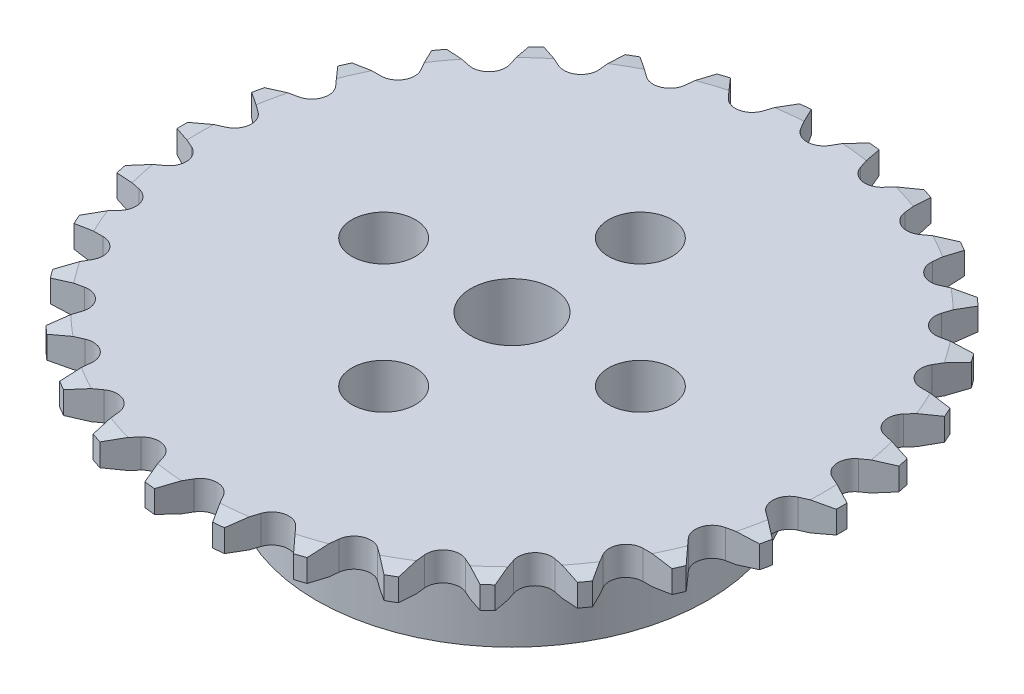
from build123d import *

# Parameters (mm, degrees)
CUT_EXTRUDE1_REACH      = 50.109
CIRPATTERN1_START       = -2.794
CIRPATTERN1_DEPTH       = 2.794
SKETCH3_R               = 4
CUT_EXTRUDE2_DEPTH      = 49.025751431
SKETCH4_R               = 19.05
CUT_EXTRUDE3_DEPTH      = 1.081
CUT_EXTRUDE4_DEPTH      = 47.887708149
CUT_EXTRUDE4_DEPTH_BACK = 47.887708149
SKETCH5_R               = 3.1


# Read off the part's stored shape, not the designer's step: CirPattern1
with BuildPart() as part:
    # Sketch1 → Revolve2 (revolve)
    with BuildSketch(Plane.XY, mode=Mode.PRIVATE) as revolve2_sk:
        Polygon((0, 0), (30.374501841, 0), (32.113107142, -0.306563023), (32.113107142, -2.487436977), (30.374501841, -2.794), (19.05, -2.794), (19.05, -15.375), (18.55, -15.875), (0, -15.875), align=None)
    revolve(revolve2_sk.sketch.rotate(Axis((0, 0, 0), (0, -1, 0)), 180), axis=Axis((0, 0, 0), (0, -1, 0)))

    # Cut-Extrude1: up to this face of the body (flat: up to its plane)
    cut_extrude1_end = Plane(part.part.faces().sort_by_distance((29.515381192, -2.794, 0))[0])
    # Sketch2 → Cut-Extrude1 (cut, up to the picked face)
    with BuildSketch(Plane(origin=(0, 0, 0), x_dir=(1, 0, 0), z_dir=(0, 1, 0)), mode=Mode.PRIVATE) as cut_extrude1_sk1:
        with BuildLine():
            Line((1.428941916, 29.549501841), (2.836569262, 31.987583922))
            ThreePointArc((2.836569262, 31.987583922), (0, 32.113107142), (-2.836569262, 31.987583922))
            Line((-2.836569262, 31.987583922), (-1.428941916, 29.549501841))
            ThreePointArc((-1.428941916, 29.549501841), (0, 28.724501841), (1.428941916, 29.549501841))
        make_face()
    cut_extrude1_tool1 = split(extrude(cut_extrude1_sk1.sketch, amount=-CUT_EXTRUDE1_REACH, mode=Mode.PRIVATE), bisect_by=cut_extrude1_end, keep=Keep.BOTH, mode=Mode.PRIVATE)
    add(cut_extrude1_tool1.solids().sort_by(Axis((0, 0, -30.720189), (0, -1, 0)))[0], mode=Mode.SUBTRACT)

    # CirPattern1 outline → CirPattern1 (cut)
    with BuildSketch(Plane(origin=(0, 0, 0), x_dir=(1, 0, 0), z_dir=(0, 1, 0)).offset(CIRPATTERN1_START)):
        with BuildLine():
            ThreePointArc((-29.120344913, -13.537250921), (-27.810766579, -16.056553571), (-26.283775651, -18.450333001))
            Line((-26.283775651, -18.450333001), (-24.876148306, -16.012250921))
            ThreePointArc((-24.876148306, -16.012250921), (-24.876148306, -14.362250921), (-26.305090222, -13.537250921))
            Line((-26.305090222, -13.537250921), (-29.120344913, -13.537250921))
        make_face()
        with BuildLine():
            ThreePointArc((-3.876009241, 31.878334378), (-6.676690404, 31.411358704), (-9.425176076, 30.698822555))
            Line((-9.425176076, 30.698822555), (-7.541402998, 28.606680599))
            ThreePointArc((-7.541402998, 28.606680599), (-5.972159746, 28.096802558), (-4.745970784, 29.200868059))
            Line((-4.745970784, 29.200868059), (-3.876009241, 31.878334378))
        make_face()
        with BuildLine():
            ThreePointArc((-10.41918754, 30.375848652), (-13.061577398, 29.336783161), (-15.601857469, 28.068375333))
            Line((-15.601857469, 28.068375333), (-13.32426858, 26.413610145))
            ThreePointArc((-13.32426858, 26.413610145), (-11.683307453, 26.24113818), (-10.713461787, 27.576016221))
            Line((-10.713461787, 27.576016221), (-10.41918754, 30.375848652))
        make_face()
        with BuildLine():
            ThreePointArc((-16.506997347, 27.545792581), (-18.875610783, 25.980049421), (-21.096662824, 24.211205423))
            Line((-21.096662824, 24.211205423), (-18.524799689, 23.06613818))
            ThreePointArc((-18.524799689, 23.06613818), (-16.883838562, 23.238610145), (-16.212723101, 24.74596015))
            Line((-16.212723101, 24.74596015), (-16.506997347, 27.545792581))
        make_face()
        with BuildLine():
            ThreePointArc((-21.873372161, 23.511853194), (-23.864689403, 21.487862854), (-25.669442781, 19.295889657))
            Line((-25.669442781, 19.295889657), (-22.91570816, 18.710565294))
            ThreePointArc((-22.91570816, 18.710565294), (-21.346464908, 19.220443334), (-21.003410618, 20.834386876))
            Line((-21.003410618, 20.834386876), (-21.873372161, 23.511853194))
        make_face()
        with BuildLine():
            ThreePointArc((-26.283775651, 18.450333001), (-27.81076658, 16.056553571), (-29.120344913, 13.537250921))
            Line((-29.120344913, 13.537250921), (-26.305090222, 13.537250921))
            ThreePointArc((-26.305090222, 13.537250921), (-24.876148306, 14.362250921), (-24.876148306, 16.012250921))
            Line((-24.876148306, 16.012250921), (-26.283775651, 18.450333001))
        make_face()
        with BuildLine():
            ThreePointArc((-29.545452022, 12.582444721), (-30.541379806, 9.923495849), (-31.298548237, 7.186969361))
            Line((-31.298548237, 7.186969361), (-28.544813616, 7.772293723))
            ThreePointArc((-28.544813616, 7.772293723), (-27.318624654, 8.876359224), (-27.661678943, 10.490302765))
            Line((-27.661678943, 10.490302765), (-29.545452022, 12.582444721))
        make_face()
        with BuildLine():
            ThreePointArc((-31.515850364, 6.164643229), (-31.937188181, 3.35673374), (-32.108854816, 0.522582753))
            Line((-32.108854816, 0.522582753), (-29.536991681, 1.667649995))
            ThreePointArc((-29.536991681, 1.667649995), (-28.567146015, 3.002528036), (-29.238261476, 4.509878041))
            Line((-29.238261476, 4.509878041), (-31.515850364, 6.164643229))
        make_face()
        with BuildLine():
            ThreePointArc((-32.108854816, -0.522582753), (-31.937188181, -3.35673374), (-31.515850364, -6.164643229))
            Line((-31.515850364, -6.164643229), (-29.238261476, -4.509878041))
            ThreePointArc((-29.238261476, -4.509878041), (-28.567146015, -3.002528036), (-29.536991681, -1.667649995))
            Line((-29.536991681, -1.667649995), (-32.108854816, -0.522582753))
        make_face()
        with BuildLine():
            ThreePointArc((-31.298548237, -7.186969361), (-30.541379806, -9.923495849), (-29.545452022, -12.582444721))
            Line((-29.545452022, -12.582444721), (-27.661678943, -10.490302765))
            ThreePointArc((-27.661678943, -10.490302765), (-27.318624654, -8.876359224), (-28.544813616, -7.772293723))
            Line((-28.544813616, -7.772293723), (-31.298548237, -7.186969361))
        make_face()
        with BuildLine():
            Line((7.541402998, 28.606680599), (9.425176076, 30.698822555))
            ThreePointArc((9.425176076, 30.698822555), (6.676690404, 31.411358704), (3.876009241, 31.878334378))
            Line((3.876009241, 31.878334378), (4.745970784, 29.200868059))
            ThreePointArc((4.745970784, 29.200868059), (5.972159746, 28.096802558), (7.541402998, 28.606680599))
        make_face()
        with BuildLine():
            Line((13.32426858, 26.413610145), (15.601857469, 28.068375333))
            ThreePointArc((15.601857469, 28.068375333), (13.061577398, 29.336783161), (10.41918754, 30.375848652))
            Line((10.41918754, 30.375848652), (10.713461787, 27.576016221))
            ThreePointArc((10.713461787, 27.576016221), (11.683307453, 26.24113818), (13.32426858, 26.413610145))
        make_face()
        with BuildLine():
            Line((18.524799689, 23.06613818), (21.096662824, 24.211205423))
            ThreePointArc((21.096662824, 24.211205423), (18.875610783, 25.980049421), (16.506997347, 27.545792581))
            Line((16.506997347, 27.545792581), (16.212723101, 24.74596015))
            ThreePointArc((16.212723101, 24.74596015), (16.883838562, 23.238610145), (18.524799689, 23.06613818))
        make_face()
        with BuildLine():
            Line((22.91570816, 18.710565294), (25.669442781, 19.295889657))
            ThreePointArc((25.669442781, 19.295889657), (23.864689403, 21.487862854), (21.873372161, 23.511853194))
            Line((21.873372161, 23.511853194), (21.003410618, 20.834386876))
            ThreePointArc((21.003410618, 20.834386876), (21.346464908, 19.220443334), (22.91570816, 18.710565294))
        make_face()
        with BuildLine():
            Line((26.305090222, 13.537250921), (29.120344913, 13.537250921))
            ThreePointArc((29.120344913, 13.537250921), (27.81076658, 16.056553571), (26.283775651, 18.450333001))
            Line((26.283775651, 18.450333001), (24.876148306, 16.012250921))
            ThreePointArc((24.876148306, 16.012250921), (24.876148306, 14.362250921), (26.305090222, 13.537250921))
        make_face()
        with BuildLine():
            Line((28.544813616, 7.772293723), (31.298548237, 7.186969361))
            ThreePointArc((31.298548237, 7.186969361), (30.541379806, 9.923495849), (29.545452022, 12.582444721))
            Line((29.545452022, 12.582444721), (27.661678943, 10.490302765))
            ThreePointArc((27.661678943, 10.490302765), (27.318624654, 8.876359224), (28.544813616, 7.772293723))
        make_face()
        with BuildLine():
            Line((29.536991681, 1.667649995), (32.108854816, 0.522582753))
            ThreePointArc((32.108854816, 0.522582753), (31.937188181, 3.35673374), (31.515850364, 6.164643229))
            Line((31.515850364, 6.164643229), (29.238261476, 4.509878041))
            ThreePointArc((29.238261476, 4.509878041), (28.567146015, 3.002528036), (29.536991681, 1.667649995))
        make_face()
        with BuildLine():
            Line((29.238261476, -4.509878041), (31.515850364, -6.164643229))
            ThreePointArc((31.515850364, -6.164643229), (31.937188181, -3.35673374), (32.108854816, -0.522582753))
            Line((32.108854816, -0.522582753), (29.536991681, -1.667649995))
            ThreePointArc((29.536991681, -1.667649995), (28.567146015, -3.002528036), (29.238261476, -4.509878041))
        make_face()
        with BuildLine():
            Line((27.661678943, -10.490302765), (29.545452022, -12.582444721))
            ThreePointArc((29.545452022, -12.582444721), (30.541379806, -9.923495849), (31.298548237, -7.186969361))
            Line((31.298548237, -7.186969361), (28.544813616, -7.772293723))
            ThreePointArc((28.544813616, -7.772293723), (27.318624654, -8.876359224), (27.661678943, -10.490302765))
        make_face()
        with BuildLine():
            Line((24.876148306, -16.012250921), (26.283775651, -18.450333001))
            ThreePointArc((26.283775651, -18.450333001), (27.810766579, -16.056553571), (29.120344913, -13.537250921))
            Line((29.120344913, -13.537250921), (26.305090222, -13.537250921))
            ThreePointArc((26.305090222, -13.537250921), (24.876148306, -14.362250921), (24.876148306, -16.012250921))
        make_face()
        with BuildLine():
            Line((21.003410618, -20.834386876), (21.873372161, -23.511853194))
            ThreePointArc((21.873372161, -23.511853194), (23.864689403, -21.487862854), (25.669442781, -19.295889657))
            Line((25.669442781, -19.295889657), (22.91570816, -18.710565294))
            ThreePointArc((22.91570816, -18.710565294), (21.346464908, -19.220443334), (21.003410618, -20.834386876))
        make_face()
        with BuildLine():
            Line((16.212723101, -24.74596015), (16.506997347, -27.545792581))
            ThreePointArc((16.506997347, -27.545792581), (18.875610783, -25.98004942), (21.096662824, -24.211205423))
            Line((21.096662824, -24.211205423), (18.524799689, -23.06613818))
            ThreePointArc((18.524799689, -23.06613818), (16.883838562, -23.238610145), (16.212723101, -24.74596015))
        make_face()
        with BuildLine():
            Line((10.713461787, -27.576016221), (10.41918754, -30.375848652))
            ThreePointArc((10.41918754, -30.375848652), (13.061577398, -29.33678316), (15.601857469, -28.068375333))
            Line((15.601857469, -28.068375333), (13.32426858, -26.413610145))
            ThreePointArc((13.32426858, -26.413610145), (11.683307453, -26.24113818), (10.713461787, -27.576016221))
        make_face()
        with BuildLine():
            Line((4.745970784, -29.200868059), (3.876009241, -31.878334377))
            ThreePointArc((3.876009241, -31.878334377), (6.676690403, -31.411358703), (9.425176076, -30.698822555))
            Line((9.425176076, -30.698822555), (7.541402998, -28.606680599))
            ThreePointArc((7.541402998, -28.606680599), (5.972159746, -28.096802558), (4.745970784, -29.200868059))
        make_face()
        with BuildLine():
            Line((-1.428941916, -29.549501841), (-2.836569262, -31.987583922))
            ThreePointArc((-2.836569262, -31.987583922), (0, -32.113107142), (2.836569262, -31.987583922))
            Line((2.836569262, -31.987583922), (1.428941916, -29.549501841))
            ThreePointArc((1.428941916, -29.549501841), (0, -28.724501841), (-1.428941916, -29.549501841))
        make_face()
        with BuildLine():
            Line((-7.541402998, -28.606680599), (-9.425176076, -30.698822555))
            ThreePointArc((-9.425176076, -30.698822555), (-6.676690403, -31.411358703), (-3.876009241, -31.878334377))
            Line((-3.876009241, -31.878334377), (-4.745970784, -29.200868059))
            ThreePointArc((-4.745970784, -29.200868059), (-5.972159746, -28.096802558), (-7.541402998, -28.606680599))
        make_face()
        with BuildLine():
            Line((-13.32426858, -26.413610145), (-15.601857469, -28.068375333))
            ThreePointArc((-15.601857469, -28.068375333), (-13.061577398, -29.33678316), (-10.41918754, -30.375848652))
            Line((-10.41918754, -30.375848652), (-10.713461787, -27.576016221))
            ThreePointArc((-10.713461787, -27.576016221), (-11.683307453, -26.24113818), (-13.32426858, -26.413610145))
        make_face()
        with BuildLine():
            Line((-18.524799689, -23.06613818), (-21.096662824, -24.211205423))
            ThreePointArc((-21.096662824, -24.211205423), (-18.875610783, -25.98004942), (-16.506997347, -27.545792581))
            Line((-16.506997347, -27.545792581), (-16.212723101, -24.74596015))
            ThreePointArc((-16.212723101, -24.74596015), (-16.883838562, -23.238610145), (-18.524799689, -23.06613818))
        make_face()
        with BuildLine():
            Line((-22.91570816, -18.710565294), (-25.669442781, -19.295889657))
            ThreePointArc((-25.669442781, -19.295889657), (-23.864689403, -21.487862854), (-21.873372161, -23.511853194))
            Line((-21.873372161, -23.511853194), (-21.003410618, -20.834386876))
            ThreePointArc((-21.003410618, -20.834386876), (-21.346464908, -19.220443334), (-22.91570816, -18.710565294))
        make_face()
    extrude(amount=CIRPATTERN1_DEPTH, mode=Mode.SUBTRACT)

    # Sketch3 → Cut-Extrude2 (cut, through all)
    with BuildSketch(Plane.XZ.offset(15.875)):
        Circle(SKETCH3_R)
    extrude(amount=-CUT_EXTRUDE2_DEPTH, mode=Mode.SUBTRACT)

    # Sketch4 → Cut-Extrude3 (cut)
    with BuildSketch(Plane.XZ.offset(15.875)):
        with Locations(Location((0, 0, 0), (0, 0, 180))):
            Circle(SKETCH4_R)
    extrude(amount=-CUT_EXTRUDE3_DEPTH, mode=Mode.SUBTRACT)

    # Sketch5 → Cut-Extrude4 (cut, two sides: drawn at the far end of the back side and taken through both)
    with BuildSketch(Plane.XZ.offset(2.794).offset(-CUT_EXTRUDE4_DEPTH_BACK)):
        with Locations((0, 12.5)):
            Circle(SKETCH5_R)
        with Locations((12.5, 0)):
            Circle(SKETCH5_R)
        with Locations((0, -12.5)):
            Circle(SKETCH5_R)
        with Locations((-12.5, 0)):
            Circle(SKETCH5_R)
    extrude(amount=CUT_EXTRUDE4_DEPTH + CUT_EXTRUDE4_DEPTH_BACK, mode=Mode.SUBTRACT)


solid = part.part
